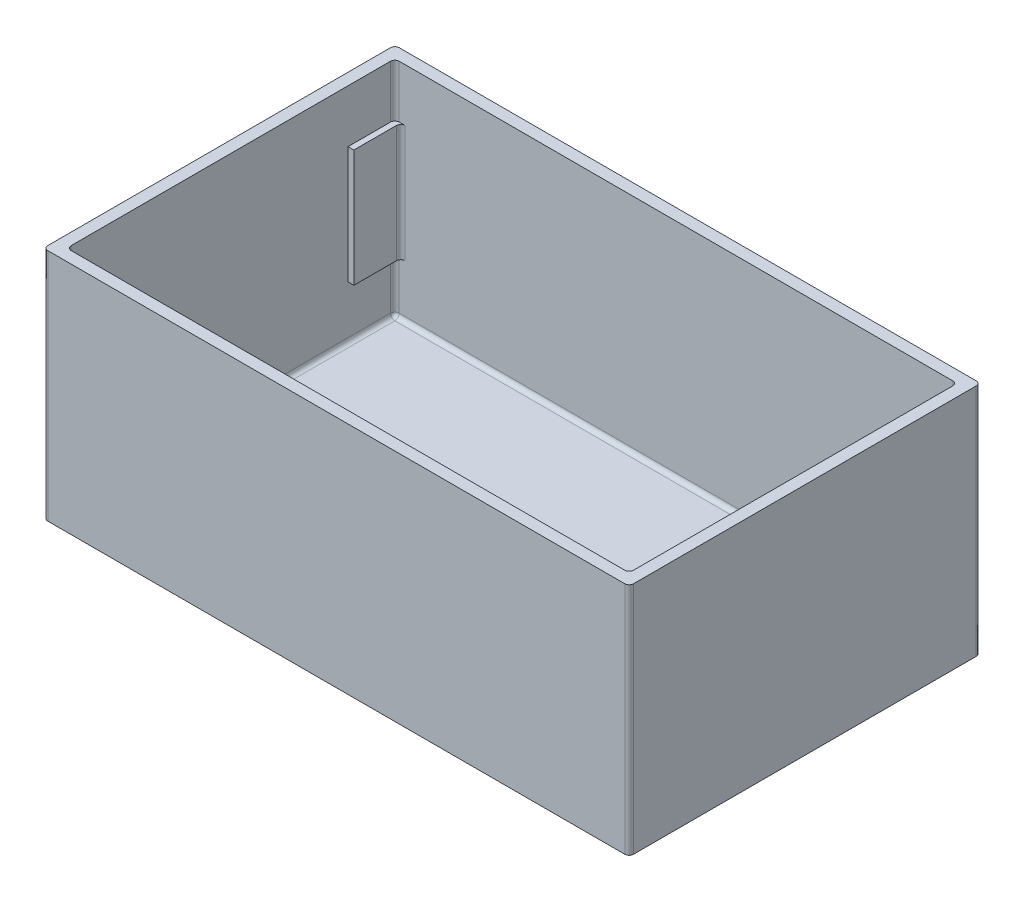
from build123d import *

# Parameters (mm, degrees)
SKETCH10_W          = 100
SKETCH10_H          = 60
BOSS_EXTRUDE2_DEPTH = 40
SHELL1_T            = -2
SKETCH11_W          = 8
SKETCH11_H          = 20
BOSS_EXTRUDE3_DEPTH = 1
FILLET1_R           = 0.75
FILLET2_R           = 0.75
FILLET3_R           = 0.75
FILLET4_R           = 0.75
FILLET5_R           = 0.75


with BuildPart() as part:
    # Sketch10 → Boss-Extrude2 (new body)
    with BuildSketch(Plane(origin=(0, 0, 0), x_dir=(1, 0, 0), z_dir=(0, 1, 0))):
        Rectangle(SKETCH10_W, SKETCH10_H)
    extrude(amount=BOSS_EXTRUDE2_DEPTH)

    # Shell1
    shell1_openings = [part.faces().sort_by_distance(p)[0] for p in [
        (0, 40, 0),
    ]]
    offset(amount=SHELL1_T, openings=shell1_openings, kind=Kind.INTERSECTION)

    # Sketch11 → Boss-Extrude3 (add)
    with BuildSketch(Plane(origin=(-48, 0, 0), x_dir=(0, 0, -1), z_dir=(1, 0, 0))):
        with Locations((24, 21)):
            Rectangle(SKETCH11_W, SKETCH11_H)
        with Locations((-24, 21)):
            Rectangle(SKETCH11_W, SKETCH11_H)
    boss_extrude3 = extrude(amount=BOSS_EXTRUDE3_DEPTH)

    # Fillet1
    fillet1_edges = [part.edges().sort_by_distance(p)[0] for p in [
        (-47, 21, -28),
        (-47, 21, 28),
    ]]
    fillet(fillet1_edges, radius=FILLET1_R)

    # Mirror1: Boss-Extrude3 across plane
    add(boss_extrude3.mirror(Plane(origin=(0, 0, 0), x_dir=(0, 0, 1), z_dir=(1, 0, 0))))

    # Fillet2
    fillet2_edges = [part.edges().sort_by_distance(p)[0] for p in [
        (47, 21, -28),
        (47, 21, 28),
    ]]
    fillet(fillet2_edges, radius=FILLET2_R)

    # Fillet3
    fillet3_edges = [part.edges().sort_by_distance(p)[0] for p in [
        (48, 2, 0),
        (0, 2, -28),
        (-48, 2, 0),
        (0, 2, 28),
    ]]
    fillet(fillet3_edges, radius=FILLET3_R)

    # Fillet4
    fillet4_edges = [part.edges().sort_by_distance(p)[0] for p in [
        (50, 20, 30),
        (-50, 20, 30),
        (-50, 20, -30),
        (50, 20, -30),
    ]]
    fillet(fillet4_edges, radius=FILLET4_R)

    # Fillet5
    # the kernel refuses this fillet: 0.75 mm, written as the material it adds along each edge
    with BuildSketch(Plane(origin=(-47.25, 2.75, -27.25), x_dir=(0, 0, -1), z_dir=(-1, 0, 0))) as fillet5_piece_1_section:
        Polygon((0, 0), (FILLET5_R, 0), (FILLET5_R, FILLET5_R), (0, FILLET5_R), align=None)
    fillet5_piece_1 = extrude(amount=FILLET5_R, mode=Mode.PRIVATE)
    fillet5_piece_1 = fillet5_piece_1 - Plane(origin=(-47.25, 2.75, -27.25), x_dir=(0, 0.7071067811865475, 0.7071067811865475), z_dir=(-1, 0, 0)) * Sphere(FILLET5_R, mode=Mode.PRIVATE)
    add(fillet5_piece_1)
    with BuildSketch(Plane(origin=(47.25, 2.75, -27.25), x_dir=(1, 0, 0), z_dir=(0, 0, -1))) as fillet5_piece_2_section:
        Polygon((0, 0), (FILLET5_R, 0), (FILLET5_R, FILLET5_R), (0, FILLET5_R), align=None)
    fillet5_piece_2 = extrude(amount=FILLET5_R, mode=Mode.PRIVATE)
    fillet5_piece_2 = fillet5_piece_2 - Plane(origin=(47.25, 2.75, -27.25), x_dir=(-0.7071067811865475, 0.7071067811865475, 0), z_dir=(0, 0, -1)) * Sphere(FILLET5_R, mode=Mode.PRIVATE)
    add(fillet5_piece_2)
    with BuildSketch(Plane(origin=(-47.25, 2.75, 27.25), x_dir=(-1, 0, 0), z_dir=(0, 0, 1))) as fillet5_piece_3_section:
        Polygon((0, 0), (FILLET5_R, 0), (FILLET5_R, FILLET5_R), (0, FILLET5_R), align=None)
    fillet5_piece_3 = extrude(amount=FILLET5_R, mode=Mode.PRIVATE)
    fillet5_piece_3 = fillet5_piece_3 - Plane(origin=(-47.25, 2.75, 27.25), x_dir=(0.7071067811865475, 0.7071067811865475, 0), z_dir=(0, 0, 1)) * Sphere(FILLET5_R, mode=Mode.PRIVATE)
    add(fillet5_piece_3)
    with BuildSketch(Plane(origin=(47.25, 2.75, 27.25), x_dir=(1, 0, 0), z_dir=(0, 0, 1))) as fillet5_piece_4_section:
        Polygon((0, 0), (FILLET5_R, 0), (FILLET5_R, -FILLET5_R), (0, -FILLET5_R), align=None)
    fillet5_piece_4 = extrude(amount=FILLET5_R, mode=Mode.PRIVATE)
    fillet5_piece_4 = fillet5_piece_4 - Plane(origin=(47.25, 2.75, 27.25), x_dir=(-0.7071067811865475, 0.7071067811865475, 0), z_dir=(0, 0, 1)) * Sphere(FILLET5_R, mode=Mode.PRIVATE)
    add(fillet5_piece_4)
    with BuildSketch(Plane(origin=(48, 29.125, 28), x_dir=(-1, 0, 0), z_dir=(0, 1, 0)), Plane(origin=(-48, 40, 28), x_dir=(1, 0, 0), z_dir=(0, -1, 0))) as fillet5_piece_5:
        with BuildLine():
            CenterArc((FILLET5_R, -FILLET5_R), FILLET5_R, 90, 90)
            Line((0, -FILLET5_R), (0, 0))
            Line((0, 0), (FILLET5_R, 0))
        make_face()
    extrude(amount=10.875)
    with BuildSketch(Plane(origin=(48, 29.125, -28), x_dir=(-1, 0, 0), z_dir=(0, 1, 0)), Plane(origin=(-48, 29.125, -28), x_dir=(0, 0, 1), z_dir=(0, 1, 0))) as fillet5_piece_6:
        with BuildLine():
            CenterArc((FILLET5_R, FILLET5_R), FILLET5_R, 180, 90)
            Line((0, FILLET5_R), (0, 0))
            Line((0, 0), (FILLET5_R, 0))
        make_face()
    extrude(amount=10.875)
    with BuildSketch(Plane(origin=(-48, 2.75, -28), x_dir=(0, 0, 1), z_dir=(0, 1, 0)), Plane(origin=(48, 2.75, -28), x_dir=(-1, 0, 0), z_dir=(0, 1, 0))) as fillet5_piece_7:
        with BuildLine():
            CenterArc((FILLET5_R, FILLET5_R), FILLET5_R, 180, 90)
            Line((0, FILLET5_R), (0, 0))
            Line((0, 0), (FILLET5_R, 0))
        make_face()
    extrude(amount=10.125)
    with BuildSketch(Plane(origin=(-48, 12.875, 28), x_dir=(1, 0, 0), z_dir=(0, -1, 0)), Plane(origin=(48, 2.75, 28), x_dir=(-1, 0, 0), z_dir=(0, 1, 0))) as fillet5_piece_8:
        with BuildLine():
            CenterArc((FILLET5_R, -FILLET5_R), FILLET5_R, 90, 90)
            Line((0, -FILLET5_R), (0, 0))
            Line((0, 0), (FILLET5_R, 0))
        make_face()
    extrude(amount=10.125)


solid = part.part
